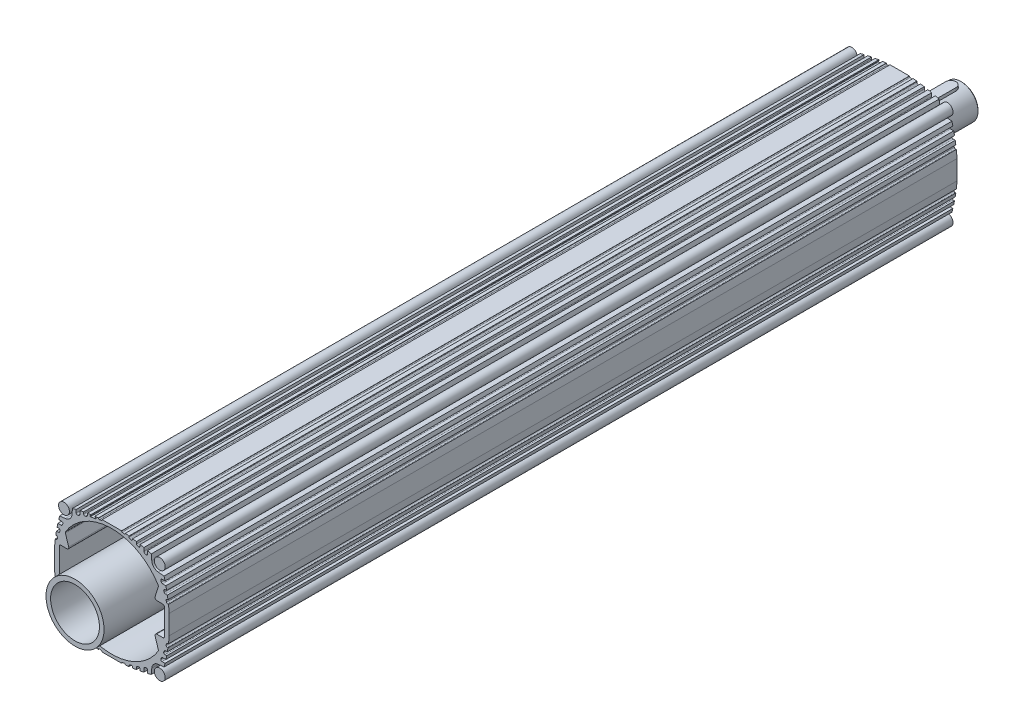
from build123d import *

# Parameters (mm, degrees)
SKETCH1_R                = 9.525
STROKE_DEPENDENT_DEPTH   = 1378.331
STROKE_DEPENDENT_2_DEPTH = 1378.331
STROKE_DEPENDENT_3_DEPTH = 1378.331
STROKE_DEPENDENT_4_DEPTH = 1378.331
STROKE_DEPENDENT_5_DEPTH = 1378.331
SKETCH2_W                = 127
SKETCH2_H                = 8.0645
KEYWAY_DEPTH             = 7
KEY_DEPTH                = 11


# Read off the part's stored shape, not the designer's step: 3/8-24 Tapped Hole1
with BuildPart() as part:
    # Sketch1 → STROKE DEPENDENT (new body)
    with BuildSketch(Plane.XY):
        with Locations(Location((-83.7858, 83.7858, 0), (0, 0, 180))):
            Circle(SKETCH1_R)
    extrude(amount=STROKE_DEPENDENT_DEPTH)


with BuildPart() as body_2:
    # Sketch1 → STROKE DEPENDENT 2 (new body)
    with BuildSketch(Plane.XY):
        with Locations(Location((83.7858, 83.7858, 0), (0, 0, 180))):
            Circle(SKETCH1_R)
    extrude(amount=STROKE_DEPENDENT_2_DEPTH)


with BuildPart() as body_3:
    # Sketch1 → STROKE DEPENDENT 3 (new body)
    with BuildSketch(Plane.XY):
        with Locations(Location((-83.7858, -83.7858, 0), (0, 0, 180))):
            Circle(SKETCH1_R)
    extrude(amount=STROKE_DEPENDENT_3_DEPTH)


with BuildPart() as body_4:
    # Sketch1 → STROKE DEPENDENT 4 (new body)
    with BuildSketch(Plane.XY):
        with Locations(Location((83.7858, -83.7858, 0), (0, 0, 180))):
            Circle(SKETCH1_R)
    extrude(amount=STROKE_DEPENDENT_4_DEPTH)


with BuildPart() as body_5:
    # Sketch1 → STROKE DEPENDENT 5 (new body)
    with BuildSketch(Plane.XY):
        with BuildLine():
            Line((-97.063667741, 42.934447658), (-93.653202538, 42.934447658))
            ThreePointArc((-93.653202538, 42.934447658), (-92.325585412, 43.359472439), (-91.491642982, 44.476501232))
            Line((-91.491642982, 44.476501232), (-90.826553736, 46.378762525))
            ThreePointArc((-90.826553736, 46.378762525), (-91.113336941, 48.46227334), (-92.980759855, 49.429740951))
            Line((-92.980759855, 49.429740951), (-95.864312854, 49.429740951))
            ThreePointArc((-95.864312854, 49.429740951), (-95.205183707, 52.681333662), (-94.508252633, 55.925034245))
            Line((-94.508252633, 55.925034245), (-88.693115346, 55.925034245))
            ThreePointArc((-88.693115346, 55.925034245), (-87.42812695, 56.306933313), (-86.585796375, 57.325030433))
            Line((-86.585796375, 57.325030433), (-85.774789113, 59.227291726))
            ThreePointArc((-85.774789113, 59.227291726), (-85.962738251, 61.389778081), (-87.873141332, 62.420327538))
            Line((-87.873141332, 62.420327538), (-92.993184046, 62.420327538))
            ThreePointArc((-92.993184046, 62.420327538), (-92.173940733, 65.672906897), (-91.316480281, 68.915620831))
            Line((-91.316480281, 68.915620831), (-81.379684179, 69.791329707))
            ThreePointArc((-81.379684179, 69.791329707), (-73.511499115, 73.464882928), (-69.842937704, 81.335396674))
            Line((-69.842937704, 81.335396674), (-68.971018715, 91.301476325))
            ThreePointArc((-68.971018715, 91.301476325), (-65.70069256, 92.166766613), (-62.420327538, 92.993184046))
            Line((-62.420327538, 92.993184046), (-62.420327538, 87.873141332))
            ThreePointArc((-62.420327538, 87.873141332), (-61.389778081, 85.962738251), (-59.227291726, 85.774789113))
            Line((-59.227291726, 85.774789113), (-57.325030433, 86.585796375))
            ThreePointArc((-57.325030433, 86.585796375), (-56.306933313, 87.42812695), (-55.925034245, 88.693115346))
            Line((-55.925034245, 88.693115346), (-55.925034245, 94.508252633))
            ThreePointArc((-55.925034245, 94.508252633), (-52.681333662, 95.205183707), (-49.429740951, 95.864312854))
            Line((-49.429740951, 95.864312854), (-49.429740951, 92.980759855))
            ThreePointArc((-49.429740951, 92.980759855), (-48.46227334, 91.113336941), (-46.378762525, 90.826553736))
            Line((-46.378762525, 90.826553736), (-44.476501232, 91.491642982))
            ThreePointArc((-44.476501232, 91.491642982), (-43.359472439, 92.325585412), (-42.934447658, 93.653202538))
            Line((-42.934447658, 93.653202538), (-42.934447658, 97.063667741))
            ThreePointArc((-42.934447658, 97.063667741), (-39.764304003, 97.592741973), (-36.588396311, 98.086037693))
            Line((-36.588396311, 98.086037693), (-36.374626091, 96.528201168))
            Line((-36.374626091, 96.528201168), (-37.392024128, 96.388535178))
            ThreePointArc((-37.392024128, 96.388535178), (-38.206181224, 95.315278378), (-37.132924424, 94.501121282))
            Line((-37.132924424, 94.501121282), (-28.303699674, 95.713176321))
            ThreePointArc((-28.303699674, 95.713176321), (-27.489542579, 96.786433121), (-28.562799379, 97.600590217))
            Line((-28.562799379, 97.600590217), (-29.580355604, 97.460902518))
            Line((-29.580355604, 97.460902518), (-29.794136406, 99.018737586))
            ThreePointArc((-29.794136406, 99.018737586), (-26.623372434, 99.397184558), (-23.448567778, 99.740086397))
            Line((-23.448567778, 99.740086397), (-23.448567778, 99.40997868))
            ThreePointArc((-23.448567778, 99.40997868), (-22.879485071, 98.222245982), (-21.597243679, 97.921544962))
            ThreePointArc((-21.597243679, 97.921544962), (-19.887886075, 98.28988211), (-18.175474555, 98.643749963))
            ThreePointArc((-18.175474555, 98.643749963), (-17.297962775, 99.172579106), (-16.953577215, 100.137506965))
            Line((-16.953577215, 100.137506965), (-16.953577215, 100.3298095))
            Line((-16.953577215, 100.3298095), (16.953577215, 100.3298095))
            Line((16.953577215, 100.3298095), (16.953577215, 100.137506965))
            ThreePointArc((16.953577215, 100.137506965), (17.297962775, 99.172579106), (18.175474555, 98.643749963))
            ThreePointArc((18.175474555, 98.643749963), (19.887886075, 98.28988211), (21.597243679, 97.921544962))
            ThreePointArc((21.597243679, 97.921544962), (22.879485071, 98.222245982), (23.448567778, 99.40997868))
            Line((23.448567778, 99.40997868), (23.448567778, 99.740086397))
            ThreePointArc((23.448567778, 99.740086397), (26.698336292, 99.388652799), (29.943861071, 98.999975716))
            Line((29.943861071, 98.999975716), (29.943861071, 97.656773257))
            ThreePointArc((29.943861071, 97.656773257), (30.413034945, 96.26935161), (31.627972031, 95.451433015))
            Line((31.627972031, 95.451433015), (33.530233324, 94.9224892))
            ThreePointArc((33.530233324, 94.9224892), (35.531885394, 95.298551332), (36.439154365, 97.121981273))
            Line((36.439154365, 97.121981273), (36.439154365, 98.108317253))
            ThreePointArc((36.439154365, 98.108317253), (39.689814966, 97.60473229), (42.934447658, 97.063667741))
            Line((42.934447658, 97.063667741), (42.934447658, 93.653202538))
            ThreePointArc((42.934447658, 93.653202538), (43.359472439, 92.325585412), (44.476501232, 91.491642982))
            Line((44.476501232, 91.491642982), (46.378762525, 90.826553736))
            ThreePointArc((46.378762525, 90.826553736), (48.46227334, 91.113336941), (49.429740951, 92.980759855))
            Line((49.429740951, 92.980759855), (49.429740951, 95.864312854))
            ThreePointArc((49.429740951, 95.864312854), (52.681333662, 95.205183707), (55.925034245, 94.508252633))
            Line((55.925034245, 94.508252633), (55.925034245, 88.693115346))
            ThreePointArc((55.925034245, 88.693115346), (56.306933313, 87.42812695), (57.325030433, 86.585796375))
            Line((57.325030433, 86.585796375), (59.227291726, 85.774789113))
            ThreePointArc((59.227291726, 85.774789113), (61.389778081, 85.962738251), (62.420327538, 87.873141332))
            Line((62.420327538, 87.873141332), (62.420327538, 92.993184046))
            ThreePointArc((62.420327538, 92.993184046), (65.672906897, 92.173940733), (68.915620831, 91.316480281))
            Line((68.915620831, 91.316480281), (69.791329707, 81.379684179))
            ThreePointArc((69.791329707, 81.379684179), (73.464882928, 73.511499115), (81.335396674, 69.842937704))
            Line((81.335396674, 69.842937704), (91.301476325, 68.971018715))
            ThreePointArc((91.301476325, 68.971018715), (92.166766613, 65.70069256), (92.993184046, 62.420327538))
            Line((92.993184046, 62.420327538), (87.873141332, 62.420327538))
            ThreePointArc((87.873141332, 62.420327538), (85.962738251, 61.389778081), (85.774789113, 59.227291726))
            Line((85.774789113, 59.227291726), (86.585796375, 57.325030433))
            ThreePointArc((86.585796375, 57.325030433), (87.42812695, 56.306933313), (88.693115346, 55.925034245))
            Line((88.693115346, 55.925034245), (94.508252633, 55.925034245))
            ThreePointArc((94.508252633, 55.925034245), (95.205183707, 52.681333662), (95.864312854, 49.429740951))
            Line((95.864312854, 49.429740951), (92.980759855, 49.429740951))
            ThreePointArc((92.980759855, 49.429740951), (91.113336941, 48.46227334), (90.826553736, 46.378762525))
            Line((90.826553736, 46.378762525), (91.491642982, 44.476501232))
            ThreePointArc((91.491642982, 44.476501232), (92.325585412, 43.359472439), (93.653202538, 42.934447658))
            Line((93.653202538, 42.934447658), (97.063667741, 42.934447658))
            ThreePointArc((97.063667741, 42.934447658), (97.60473229, 39.689814966), (98.108317253, 36.439154365))
            Line((98.108317253, 36.439154365), (97.121981273, 36.439154365))
            ThreePointArc((97.121981273, 36.439154365), (95.298551332, 35.531885394), (94.9224892, 33.530233324))
            Line((94.9224892, 33.530233324), (95.451433015, 31.627972031))
            ThreePointArc((95.451433015, 31.627972031), (96.26935161, 30.413034945), (97.656773257, 29.943861071))
            Line((97.656773257, 29.943861071), (98.999975716, 29.943861071))
            ThreePointArc((98.999975716, 29.943861071), (99.739291317, 23.456335445), (100.3298095, 16.953577215))
            Line((100.3298095, 16.953577215), (100.3298095, -16.953577215))
            ThreePointArc((100.3298095, -16.953577215), (99.739291317, -23.456335445), (98.999975716, -29.943861071))
            Line((98.999975716, -29.943861071), (97.656773257, -29.943861071))
            ThreePointArc((97.656773257, -29.943861071), (96.26935161, -30.413034945), (95.451433015, -31.627972031))
            Line((95.451433015, -31.627972031), (94.9224892, -33.530233324))
            ThreePointArc((94.9224892, -33.530233324), (95.298551332, -35.531885394), (97.121981273, -36.439154365))
            Line((97.121981273, -36.439154365), (98.108317253, -36.439154365))
            ThreePointArc((98.108317253, -36.439154365), (97.60473229, -39.689814966), (97.063667741, -42.934447658))
            Line((97.063667741, -42.934447658), (93.653202538, -42.934447658))
            ThreePointArc((93.653202538, -42.934447658), (92.325585412, -43.359472439), (91.491642982, -44.476501232))
            Line((91.491642982, -44.476501232), (90.826553736, -46.378762525))
            ThreePointArc((90.826553736, -46.378762525), (91.113336941, -48.46227334), (92.980759855, -49.429740951))
            Line((92.980759855, -49.429740951), (95.864312854, -49.429740951))
            ThreePointArc((95.864312854, -49.429740951), (95.205183707, -52.681333662), (94.508252633, -55.925034245))
            Line((94.508252633, -55.925034245), (88.693115346, -55.925034245))
            ThreePointArc((88.693115346, -55.925034245), (87.42812695, -56.306933313), (86.585796375, -57.325030433))
            Line((86.585796375, -57.325030433), (85.774789113, -59.227291726))
            ThreePointArc((85.774789113, -59.227291726), (85.962738251, -61.389778081), (87.873141332, -62.420327538))
            Line((87.873141332, -62.420327538), (92.993184046, -62.420327538))
            ThreePointArc((92.993184046, -62.420327538), (92.173940733, -65.672906897), (91.316480281, -68.915620831))
            Line((91.316480281, -68.915620831), (81.379684179, -69.791329707))
            ThreePointArc((81.379684179, -69.791329707), (73.511499115, -73.464882928), (69.842937704, -81.335396674))
            Line((69.842937704, -81.335396674), (68.971018715, -91.301476325))
            ThreePointArc((68.971018715, -91.301476325), (65.70069256, -92.166766613), (62.420327538, -92.993184046))
            Line((62.420327538, -92.993184046), (62.420327538, -87.873141332))
            ThreePointArc((62.420327538, -87.873141332), (61.389778081, -85.962738251), (59.227291726, -85.774789113))
            Line((59.227291726, -85.774789113), (57.325030433, -86.585796375))
            ThreePointArc((57.325030433, -86.585796375), (56.306933313, -87.42812695), (55.925034245, -88.693115346))
            Line((55.925034245, -88.693115346), (55.925034245, -94.508252633))
            ThreePointArc((55.925034245, -94.508252633), (52.681333662, -95.205183707), (49.429740951, -95.864312854))
            Line((49.429740951, -95.864312854), (49.429740951, -92.980759855))
            ThreePointArc((49.429740951, -92.980759855), (48.46227334, -91.113336941), (46.378762525, -90.826553736))
            Line((46.378762525, -90.826553736), (44.476501232, -91.491642982))
            ThreePointArc((44.476501232, -91.491642982), (43.359472439, -92.325585412), (42.934447658, -93.653202538))
            Line((42.934447658, -93.653202538), (42.934447658, -97.063667741))
            ThreePointArc((42.934447658, -97.063667741), (39.689814966, -97.60473229), (36.439154365, -98.108317253))
            Line((36.439154365, -98.108317253), (36.439154365, -97.121981273))
            ThreePointArc((36.439154365, -97.121981273), (35.531885394, -95.298551332), (33.530233324, -94.9224892))
            Line((33.530233324, -94.9224892), (31.627972031, -95.451433015))
            ThreePointArc((31.627972031, -95.451433015), (30.413034945, -96.26935161), (29.943861071, -97.656773257))
            Line((29.943861071, -97.656773257), (29.943861071, -98.999975716))
            ThreePointArc((29.943861071, -98.999975716), (26.698336292, -99.388652799), (23.448567778, -99.740086397))
            Line((23.448567778, -99.740086397), (23.448567778, -99.40997868))
            ThreePointArc((23.448567778, -99.40997868), (22.879485071, -98.222245982), (21.597243679, -97.921544962))
            ThreePointArc((21.597243679, -97.921544962), (19.887886075, -98.28988211), (18.175474555, -98.643749963))
            ThreePointArc((18.175474555, -98.643749963), (17.297962775, -99.172579106), (16.953577215, -100.137506965))
            Line((16.953577215, -100.137506965), (16.953577215, -100.3298095))
            Line((16.953577215, -100.3298095), (-16.953577215, -100.3298095))
            Line((-16.953577215, -100.3298095), (-16.953577215, -100.137506965))
            ThreePointArc((-16.953577215, -100.137506965), (-17.297962775, -99.172579106), (-18.175474555, -98.643749963))
            ThreePointArc((-18.175474555, -98.643749963), (-19.887886075, -98.28988211), (-21.597243679, -97.921544962))
            ThreePointArc((-21.597243679, -97.921544962), (-22.879485071, -98.222245982), (-23.448567778, -99.40997868))
            Line((-23.448567778, -99.40997868), (-23.448567778, -99.740086397))
            ThreePointArc((-23.448567778, -99.740086397), (-26.698336292, -99.388652799), (-29.943861071, -98.999975716))
            Line((-29.943861071, -98.999975716), (-29.943861071, -97.656773257))
            ThreePointArc((-29.943861071, -97.656773257), (-30.413034945, -96.26935161), (-31.627972031, -95.451433015))
            Line((-31.627972031, -95.451433015), (-33.530233324, -94.9224892))
            ThreePointArc((-33.530233324, -94.9224892), (-35.531885394, -95.298551332), (-36.439154365, -97.121981273))
            Line((-36.439154365, -97.121981273), (-36.439154365, -98.108317253))
            ThreePointArc((-36.439154365, -98.108317253), (-39.689814965, -97.60473229), (-42.934447658, -97.063667741))
            Line((-42.934447658, -97.063667741), (-42.934447658, -93.653202538))
            ThreePointArc((-42.934447658, -93.653202538), (-43.359472439, -92.325585412), (-44.476501232, -91.491642982))
            Line((-44.476501232, -91.491642982), (-46.378762525, -90.826553736))
            ThreePointArc((-46.378762525, -90.826553736), (-48.46227334, -91.113336941), (-49.429740951, -92.980759855))
            Line((-49.429740951, -92.980759855), (-49.429740951, -95.864312854))
            ThreePointArc((-49.429740951, -95.864312854), (-52.681333662, -95.205183707), (-55.925034245, -94.508252633))
            Line((-55.925034245, -94.508252633), (-55.925034245, -88.693115346))
            ThreePointArc((-55.925034245, -88.693115346), (-56.306933313, -87.42812695), (-57.325030432, -86.585796375))
            Line((-57.325030432, -86.585796375), (-59.227291726, -85.774789113))
            ThreePointArc((-59.227291726, -85.774789113), (-61.389778081, -85.962738251), (-62.420327538, -87.873141332))
            Line((-62.420327538, -87.873141332), (-62.420327538, -92.993184046))
            ThreePointArc((-62.420327538, -92.993184046), (-65.672906897, -92.173940733), (-68.915620831, -91.316480281))
            Line((-68.915620831, -91.316480281), (-69.791329707, -81.379684179))
            ThreePointArc((-69.791329707, -81.379684179), (-73.464882928, -73.511499115), (-81.335396674, -69.842937704))
            Line((-81.335396674, -69.842937704), (-91.301476325, -68.971018715))
            ThreePointArc((-91.301476325, -68.971018715), (-92.166766613, -65.70069256), (-92.993184046, -62.420327538))
            Line((-92.993184046, -62.420327538), (-87.873141332, -62.420327538))
            ThreePointArc((-87.873141332, -62.420327538), (-85.962738251, -61.389778081), (-85.774789113, -59.227291726))
            Line((-85.774789113, -59.227291726), (-86.585796375, -57.325030433))
            ThreePointArc((-86.585796375, -57.325030433), (-87.42812695, -56.306933313), (-88.693115346, -55.925034245))
            Line((-88.693115346, -55.925034245), (-94.508252633, -55.925034245))
            ThreePointArc((-94.508252633, -55.925034245), (-95.205183707, -52.681333662), (-95.864312854, -49.429740951))
            Line((-95.864312854, -49.429740951), (-92.980759855, -49.429740951))
            ThreePointArc((-92.980759855, -49.429740951), (-91.113336941, -48.46227334), (-90.826553736, -46.378762525))
            Line((-90.826553736, -46.378762525), (-91.491642982, -44.476501232))
            ThreePointArc((-91.491642982, -44.476501232), (-92.325585412, -43.359472439), (-93.653202538, -42.934447658))
            Line((-93.653202538, -42.934447658), (-97.063667741, -42.934447658))
            ThreePointArc((-97.063667741, -42.934447658), (-97.60473229, -39.689814966), (-98.108317253, -36.439154365))
            Line((-98.108317253, -36.439154365), (-97.121981273, -36.439154365))
            ThreePointArc((-97.121981273, -36.439154365), (-95.298551332, -35.531885394), (-94.9224892, -33.530233324))
            Line((-94.9224892, -33.530233324), (-95.451433015, -31.627972031))
            ThreePointArc((-95.451433015, -31.627972031), (-96.26935161, -30.413034945), (-97.656773257, -29.943861071))
            Line((-97.656773257, -29.943861071), (-98.999975716, -29.943861071))
            ThreePointArc((-98.999975716, -29.943861071), (-99.739291317, -23.456335445), (-100.3298095, -16.953577215))
            Line((-100.3298095, -16.953577215), (-100.3298095, 16.953577215))
            ThreePointArc((-100.3298095, 16.953577215), (-99.739291317, 23.456335445), (-98.999975716, 29.943861071))
            Line((-98.999975716, 29.943861071), (-97.656773257, 29.943861071))
            ThreePointArc((-97.656773257, 29.943861071), (-96.26935161, 30.413034945), (-95.451433015, 31.627972031))
            Line((-95.451433015, 31.627972031), (-94.9224892, 33.530233324))
            ThreePointArc((-94.9224892, 33.530233324), (-95.298551332, 35.531885394), (-97.121981273, 36.439154365))
            Line((-97.121981273, 36.439154365), (-98.108317253, 36.439154365))
            ThreePointArc((-98.108317253, 36.439154365), (-97.60473229, 39.689814966), (-97.063667741, 42.934447658))
        make_face()
        with BuildLine():
            Line((-89.51470147, 25.3999492), (-78.602050829, 25.3999492))
            ThreePointArc((-78.602050829, 25.3999492), (-76.045400995, 26.692353485), (-75.570152863, 29.517403294))
            Line((-75.570152863, 29.517403294), (-81.338134814, 48.073142884))
            ThreePointArc((-81.338134814, 48.073142884), (-81.423239176, 49.037455184), (-81.101610831, 49.950524826))
            ThreePointArc((-81.101610831, 49.950524826), (0, 95.2498095), (81.101610831, 49.950524826))
            ThreePointArc((81.101610831, 49.950524826), (81.423239176, 49.037455184), (81.338134814, 48.073142884))
            Line((81.338134814, 48.073142884), (75.570152863, 29.517403294))
            ThreePointArc((75.570152863, 29.517403294), (76.045400995, 26.692353485), (78.602050829, 25.3999492))
            Line((78.602050829, 25.3999492), (89.51470147, 25.3999492))
            ThreePointArc((89.51470147, 25.3999492), (91.131147572, 24.730395302), (91.80070147, 23.1139492))
            Line((91.80070147, 23.1139492), (91.80070147, -23.1139492))
            ThreePointArc((91.80070147, -23.1139492), (91.131147572, -24.730395302), (89.51470147, -25.3999492))
            Line((89.51470147, -25.3999492), (78.602050829, -25.3999492))
            ThreePointArc((78.602050829, -25.3999492), (76.045400995, -26.692353485), (75.570152863, -29.517403294))
            Line((75.570152863, -29.517403294), (81.338134814, -48.073142884))
            ThreePointArc((81.338134814, -48.073142884), (81.423239176, -49.037455184), (81.101610831, -49.950524826))
            ThreePointArc((81.101610831, -49.950524826), (0, -95.2498095), (-81.101610831, -49.950524826))
            ThreePointArc((-81.101610831, -49.950524826), (-81.423239176, -49.037455184), (-81.338134814, -48.073142884))
            Line((-81.338134814, -48.073142884), (-75.570152863, -29.517403294))
            ThreePointArc((-75.570152863, -29.517403294), (-76.045400995, -26.692353485), (-78.602050829, -25.3999492))
            Line((-78.602050829, -25.3999492), (-89.51470147, -25.3999492))
            ThreePointArc((-89.51470147, -25.3999492), (-91.131147572, -24.730395302), (-91.80070147, -23.1139492))
            Line((-91.80070147, -23.1139492), (-91.80070147, 23.1139492))
            ThreePointArc((-91.80070147, 23.1139492), (-91.131147572, 24.730395302), (-89.51470147, 25.3999492))
        make_face(mode=Mode.SUBTRACT)
    extrude(amount=STROKE_DEPENDENT_5_DEPTH)


with BuildPart() as body_6:
    # Sketch2 → Revolve1 (revolve)
    with BuildSketch(Plane(origin=(0, 0, 0), x_dir=(0, 0, -1), z_dir=(1, 0, 0))):
        with Locations((-1379.2915, 46.76775)):
            Rectangle(SKETCH2_W, SKETCH2_H)
        with BuildLine():
            Line((0, 95.450989462), (0.8763, 95.450989462))
            Line((0.8763, 95.450989462), (0.8763, 65.263089462))
            ThreePointArc((0.8763, 65.263089462), (1.322669265, 64.185458728), (2.4003, 63.739089462))
            Line((2.4003, 63.739089462), (26.2763, 63.739089462))
            Line((26.2763, 63.739089462), (26.2763, 34.831489462))
            Line((26.2763, 34.831489462), (14.8021, 34.831489462))
            Line((14.8021, 34.831489462), (9.8021, 32.499951171))
            Line((9.8021, 32.499951171), (23.4787, 32.499951171))
            Line((23.4787, 32.499951171), (28.4787, 30.6801))
            Line((28.4787, 30.6801), (28.4787, 30))
            Line((28.4787, 30), (106.9787, 30))
            Line((106.9787, 30), (108.4787, 28.5))
            Line((108.4787, 28.5), (108.4787, 0))
            Line((108.4787, 0), (0, 0))
            Line((0, 0), (-50.8, 0))
            Line((-50.8, 0), (-50.8, 95.450989462))
            Line((-50.8, 95.450989462), (0, 95.450989462))
        make_face()
    revolve(axis=Axis((0, 0, 0), (0, 0, 1)))


with BuildPart() as f_3_8_24_tapped_hole1_tool:
    # 3/8-24 Tapped Hole1 outline → 3/8-24 Tapped Hole1 (revolve)
    with BuildSketch(Plane(origin=(78.038538311, 36.389968045, 0), x_dir=(1, 0, 0), z_dir=(0, -1, 0))):
        Polygon((4.2164, 21.3487), (0, 23.882168714), (0, -0.8763), (4.7625, -0.8763), (4.7625, 18.1737), (4.2164, 18.1737), align=None)
    revolve(axis=Axis((78.038538311, 36.389968045, 0), (0, 0, 1)))


with BuildPart() as body_5_1:
    add(body_5.part)

    # 3/8-24 Tapped Hole1: cut by f_3_8_24_tapped_hole1_tool
    add(f_3_8_24_tapped_hole1_tool.part, mode=Mode.SUBTRACT)


with BuildPart() as body_6_1:
    add(body_6.part)

    # 3/8-24 Tapped Hole1: cut by f_3_8_24_tapped_hole1_tool
    add(f_3_8_24_tapped_hole1_tool.part, mode=Mode.SUBTRACT)

    # 3_8-24 Tapped Hole1 2 outline → 3_8-24 Tapped Hole1 2 (revolve, cut)
    with BuildSketch(Plane(origin=(86.106, 0, 0), x_dir=(1, 0, 0), z_dir=(0, -1, 0))):
        Polygon((0, -0.8763), (4.7625, -0.8763), (4.7625, 18.1737), (4.2164, 18.1737), (4.2164, 21.3487), (0, 23.882168714), align=None)
    revolve(axis=Axis((86.106, 0, 0), (0, 0, 1)), mode=Mode.SUBTRACT)


with BuildPart() as f_3_8_24_tapped_hole1_3_tool:
    # 3_8-24 Tapped Hole1 3 outline → 3_8-24 Tapped Hole1 3 (revolve)
    with BuildSketch(Plane(origin=(78.038538311, -36.389968045, 0), x_dir=(1, 0, 0), z_dir=(0, -1, 0))):
        Polygon((4.7625, 18.1737), (4.2164, 18.1737), (4.2164, 21.3487), (0, 23.882168714), (0, -0.8763), (4.7625, -0.8763), align=None)
    revolve(axis=Axis((78.038538311, -36.389968045, 0), (0, 0, 1)))


with BuildPart() as body_5_2:
    add(body_5_1.part)

    # 3_8-24 Tapped Hole1 3: cut by f_3_8_24_tapped_hole1_3_tool
    add(f_3_8_24_tapped_hole1_3_tool.part, mode=Mode.SUBTRACT)


with BuildPart() as body_6_2:
    add(body_6_1.part)

    # 3_8-24 Tapped Hole1 3: cut by f_3_8_24_tapped_hole1_3_tool
    add(f_3_8_24_tapped_hole1_3_tool.part, mode=Mode.SUBTRACT)

    # 3_8-24 Tapped Hole1 4 outline → 3_8-24 Tapped Hole1 4 (revolve, cut)
    with BuildSketch(Plane(origin=(36.389968045, -78.038538311, 0), x_dir=(1, 0, 0), z_dir=(0, -1, 0))):
        Polygon((0, -0.8763), (4.7625, -0.8763), (4.7625, 18.1737), (4.2164, 18.1737), (4.2164, 21.3487), (0, 23.882168714), align=None)
    revolve(axis=Axis((36.389968045, -78.038538311, 0), (0, 0, 1)), mode=Mode.SUBTRACT)

    # 3_8-24 Tapped Hole1 5 outline → 3_8-24 Tapped Hole1 5 (revolve, cut)
    with BuildSketch(Plane(origin=(-36.389968045, -78.038538311, 0), x_dir=(1, 0, 0), z_dir=(0, -1, 0))):
        Polygon((0, -0.8763), (4.7625, -0.8763), (4.7625, 18.1737), (4.2164, 18.1737), (4.2164, 21.3487), (0, 23.882168714), align=None)
    revolve(axis=Axis((-36.389968045, -78.038538311, 0), (0, 0, 1)), mode=Mode.SUBTRACT)


with BuildPart() as f_3_8_24_tapped_hole1_6_tool:
    # 3_8-24 Tapped Hole1 6 outline → 3_8-24 Tapped Hole1 6 (revolve)
    with BuildSketch(Plane(origin=(-78.038538311, -36.389968045, 0), x_dir=(1, 0, 0), z_dir=(0, -1, 0))):
        Polygon((4.7625, 18.1737), (4.2164, 18.1737), (4.2164, 21.3487), (0, 23.882168714), (0, -0.8763), (4.7625, -0.8763), align=None)
    revolve(axis=Axis((-78.038538311, -36.389968045, 0), (0, 0, 1)))


with BuildPart() as body_5_3:
    add(body_5_2.part)

    # 3_8-24 Tapped Hole1 6: cut by f_3_8_24_tapped_hole1_6_tool
    add(f_3_8_24_tapped_hole1_6_tool.part, mode=Mode.SUBTRACT)


with BuildPart() as body_6_3:
    add(body_6_2.part)

    # 3_8-24 Tapped Hole1 6: cut by f_3_8_24_tapped_hole1_6_tool
    add(f_3_8_24_tapped_hole1_6_tool.part, mode=Mode.SUBTRACT)

    # 3_8-24 Tapped Hole1 7 outline → 3_8-24 Tapped Hole1 7 (revolve, cut)
    with BuildSketch(Plane(origin=(-86.106, 0, 0), x_dir=(1, 0, 0), z_dir=(0, -1, 0))):
        Polygon((0, -0.8763), (4.7625, -0.8763), (4.7625, 18.1737), (4.2164, 18.1737), (4.2164, 21.3487), (0, 23.882168714), align=None)
    revolve(axis=Axis((-86.106, 0, 0), (0, 0, 1)), mode=Mode.SUBTRACT)


with BuildPart() as f_3_8_24_tapped_hole1_8_tool:
    # 3_8-24 Tapped Hole1 8 outline → 3_8-24 Tapped Hole1 8 (revolve)
    with BuildSketch(Plane(origin=(-78.038538311, 36.389968045, 0), x_dir=(1, 0, 0), z_dir=(0, -1, 0))):
        Polygon((4.7625, 18.1737), (4.2164, 18.1737), (4.2164, 21.3487), (0, 23.882168714), (0, -0.8763), (4.7625, -0.8763), align=None)
    revolve(axis=Axis((-78.038538311, 36.389968045, 0), (0, 0, 1)))


with BuildPart() as body_5_4:
    add(body_5_3.part)

    # 3_8-24 Tapped Hole1 8: cut by f_3_8_24_tapped_hole1_8_tool
    add(f_3_8_24_tapped_hole1_8_tool.part, mode=Mode.SUBTRACT)


with BuildPart() as body_6_4:
    add(body_6_3.part)

    # 3_8-24 Tapped Hole1 8: cut by f_3_8_24_tapped_hole1_8_tool
    add(f_3_8_24_tapped_hole1_8_tool.part, mode=Mode.SUBTRACT)

    # 3_8-24 Tapped Hole1 9 outline → 3_8-24 Tapped Hole1 9 (revolve, cut)
    with BuildSketch(Plane(origin=(36.389968045, 78.038538311, 0), x_dir=(1, 0, 0), z_dir=(0, -1, 0))):
        Polygon((0, -0.8763), (4.7625, -0.8763), (4.7625, 18.1737), (4.2164, 18.1737), (4.2164, 21.3487), (0, 23.882168714), align=None)
    revolve(axis=Axis((36.389968045, 78.038538311, 0), (0, 0, 1)), mode=Mode.SUBTRACT)

    # 3_8-24 Tapped Hole1 10 outline → 3_8-24 Tapped Hole1 10 (revolve, cut)
    with BuildSketch(Plane(origin=(-36.389968045, 78.038538311, 0), x_dir=(1, 0, 0), z_dir=(0, -1, 0))):
        Polygon((0, -0.8763), (4.7625, -0.8763), (4.7625, 18.1737), (4.2164, 18.1737), (4.2164, 21.3487), (0, 23.882168714), align=None)
    revolve(axis=Axis((-36.389968045, 78.038538311, 0), (0, 0, 1)), mode=Mode.SUBTRACT)

    # Sketch5 → keyway (cut)
    with BuildSketch(Plane(origin=(0, 30, 0), x_dir=(1, 0, 0), z_dir=(0, 1, 0))):
        with BuildLine():
            Line((-9, 52.4687), (-9, 89.9887))
            ThreePointArc((-9, 89.9887), (0, 98.9887), (9, 89.9887))
            Line((9, 89.9887), (9, 52.4687))
            ThreePointArc((9, 52.4687), (0, 43.4687), (-9, 52.4687))
        make_face()
    extrude(amount=-KEYWAY_DEPTH, mode=Mode.SUBTRACT)

    # Sketch6 → key (add)
    with BuildSketch(Plane(origin=(0, 23, 0), x_dir=(1, 0, 0), z_dir=(0, 1, 0))):
        with BuildLine():
            Line((-9, 52.4687), (-9, 89.4687))
            ThreePointArc((-9, 89.4687), (0, 98.4687), (9, 89.4687))
            Line((9, 89.4687), (9, 52.4687))
            ThreePointArc((9, 52.4687), (0, 43.4687), (-9, 52.4687))
        make_face()
    extrude(amount=KEY_DEPTH)


solid = Compound([part.part, body_2.part, body_3.part, body_4.part, body_5_4.part, body_6_4.part])
